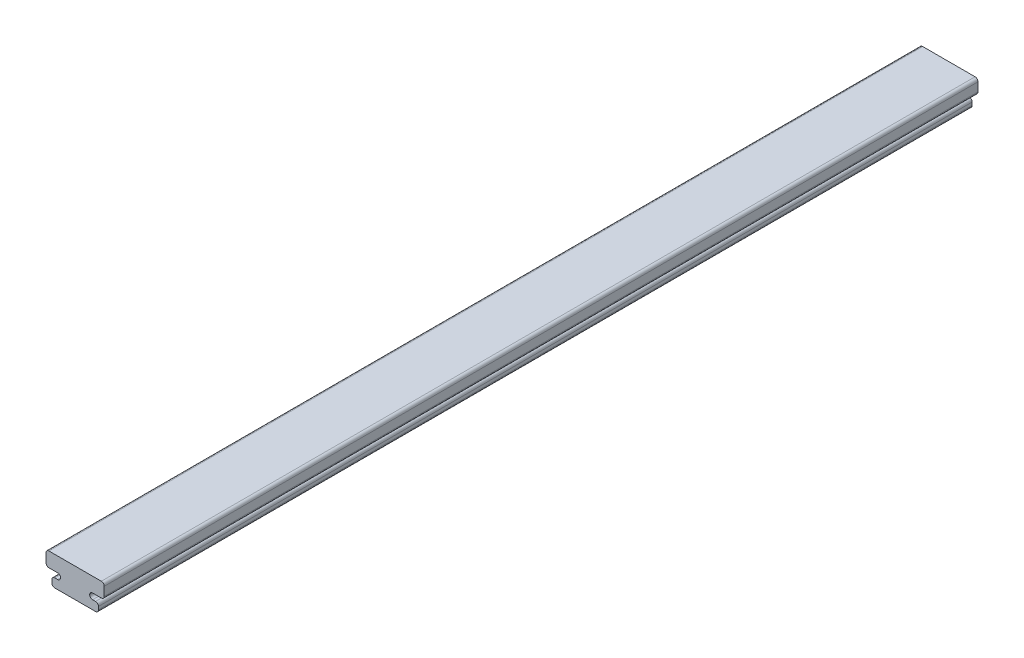
from build123d import *

# Parameters (mm, degrees)
BOSS_EXTRUDE1_DEPTH = 300
FILLET1_R           = 1


with BuildPart() as part:
    # Sketch1 → Boss-Extrude1 (new body)
    with BuildSketch(Plane.XY):
        Polygon((0, 0), (-16, 0), (-16, 3), (-13, 3), (-13, 5), (-18, 5), (-18, 10), (2, 10), (2, 5), (-3, 5), (-3, 3), (0, 3), align=None)
    extrude(amount=BOSS_EXTRUDE1_DEPTH)

    # Fillet1
    fillet1_edges = [part.edges().sort_by_distance(p)[0] for p in [
        (-13, 5, 150),
        (-13, 3, 150),
        (-3, 5, 150),
        (-3, 3, 150),
        (0, 0, 150),
        (0, 3, 150),
        (-16, 3, 150),
        (-16, 0, 150),
        (2, 5, 150),
        (-18, 5, 150),
        (2, 10, 150),
        (-18, 10, 150),
    ]]
    fillet(fillet1_edges, radius=FILLET1_R - 0.0001)  # a hair under: the kernel refuses the full size


solid = part.part
